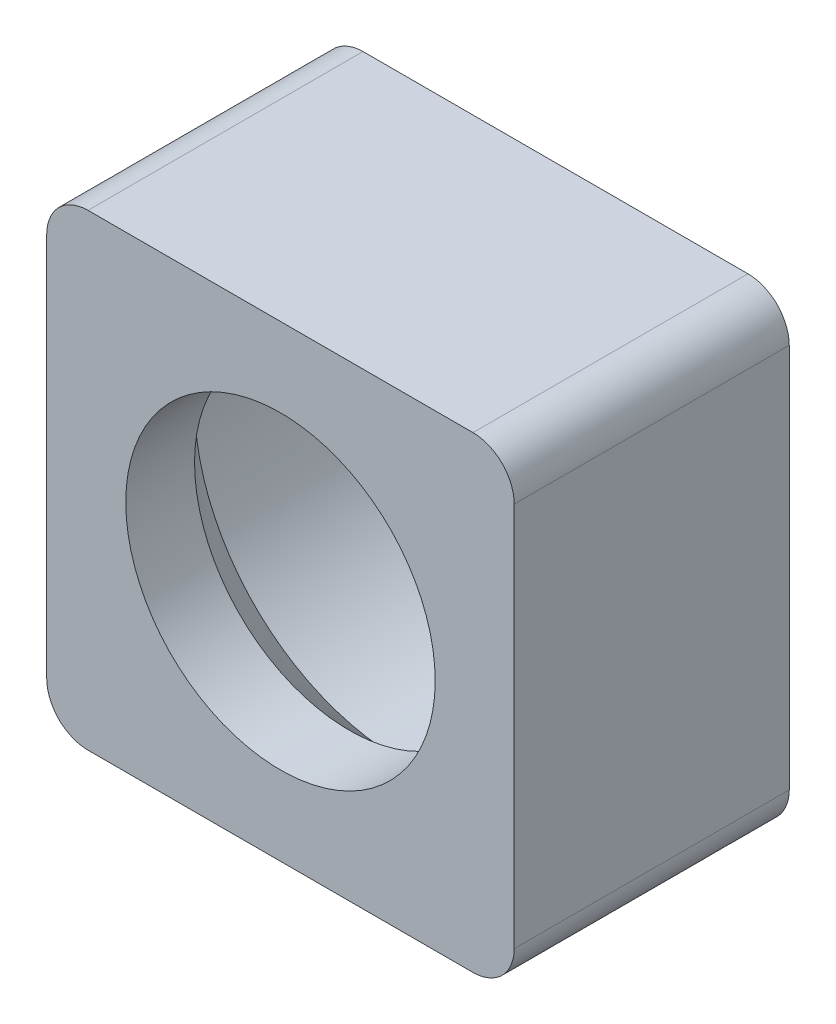
from build123d import *

# Parameters (mm, degrees)
BOSS_EXTRUDE1_DEPTH = 4
SKETCH2_R           = 2.25
CUT_EXTRUDE1_DEPTH  = 4
SKETCH3_R           = 3
CUT_EXTRUDE2_DEPTH  = 2
CHAMFER1_SIZE       = 1


with BuildPart() as part:
    # Sketch1 → Boss-Extrude1 (new body)
    with BuildSketch(Plane.XY):
        with BuildLine():
            Line((-3.399881961, 2.8), (-3.399881961, -2.8))
            add(Edge.make_bspline(
                [(-3.399881961, -2.8), (-3.399881961, -2.953071187), (-3.271882834, -3.271984466), (-2.952966029, -3.4), (-2.799893385, -3.4)],
                knots=[-1.570796327, -1.570796327, -1.570796327, -1.570796327, -0.785398163, 0, 0, 0, 0], degree=3))
            Line((-2.799893385, -3.4), (2.799893385, -3.4))
            add(Edge.make_bspline(
                [(2.799893385, -3.4), (2.952966029, -3.4), (3.271882834, -3.271984466), (3.399881961, -2.953071187), (3.399881961, -2.8)],
                knots=[0, 0, 0, 0, 0.785398163, 1.570796327, 1.570796327, 1.570796327, 1.570796327], degree=3))
            Line((3.399881961, -2.8), (3.399881961, 2.8))
            add(Edge.make_bspline(
                [(3.399881961, 2.8), (3.399881961, 2.953071187), (3.271882834, 3.271984466), (2.952966029, 3.4), (2.799893385, 3.4)],
                knots=[1.570796327, 1.570796327, 1.570796327, 1.570796327, 2.35619449, 3.141592654, 3.141592654, 3.141592654, 3.141592654], degree=3))
            Line((2.799893385, 3.4), (-2.799893385, 3.4))
            add(Edge.make_bspline(
                [(-2.799893385, 3.4), (-2.952966029, 3.4), (-3.271882834, 3.271984466), (-3.399881961, 2.953071187), (-3.399881961, 2.8)],
                knots=[-3.141592654, -3.141592654, -3.141592654, -3.141592654, -2.35619449, -1.570796327, -1.570796327, -1.570796327, -1.570796327], degree=3))
        make_face()
    extrude(amount=BOSS_EXTRUDE1_DEPTH)

    # Sketch2 → Cut-Extrude1 (cut)
    with BuildSketch(Plane.XY.offset(4)):
        Circle(SKETCH2_R)
    extrude(amount=-CUT_EXTRUDE1_DEPTH, mode=Mode.SUBTRACT)

    # Sketch3 → Cut-Extrude2 (cut)
    with BuildSketch(Plane(origin=(0, 0, 0), x_dir=(-1, 0, 0), z_dir=(0, 0, -1))):
        Circle(SKETCH3_R)
    extrude(amount=-CUT_EXTRUDE2_DEPTH, mode=Mode.SUBTRACT)

    # Chamfer1
    # the kernel refuses this chamfer: 1 mm, written as the material it takes off along each edge
    with BuildSketch(Plane(origin=(0, 0, 2), x_dir=(1, 0, 0), z_dir=(0, -1, 0))) as chamfer1_piece_1_section:
        Polygon((2.25, CHAMFER1_SIZE), (2.25 + CHAMFER1_SIZE, 0), (2.25, 0), align=None)
    chamfer1_piece_1 = revolve(axis=Axis((0, 0, 2), (0, 0, 1)), mode=Mode.PRIVATE)
    chamfer1_piece_1 = chamfer1_piece_1 & Plane(origin=(0, 0, 2.624934748), x_dir=(-1, 0, 0), z_dir=(0, 0, -1)) * Cylinder(3, 13, mode=Mode.PRIVATE)
    add(chamfer1_piece_1, mode=Mode.SUBTRACT)


solid = part.part
